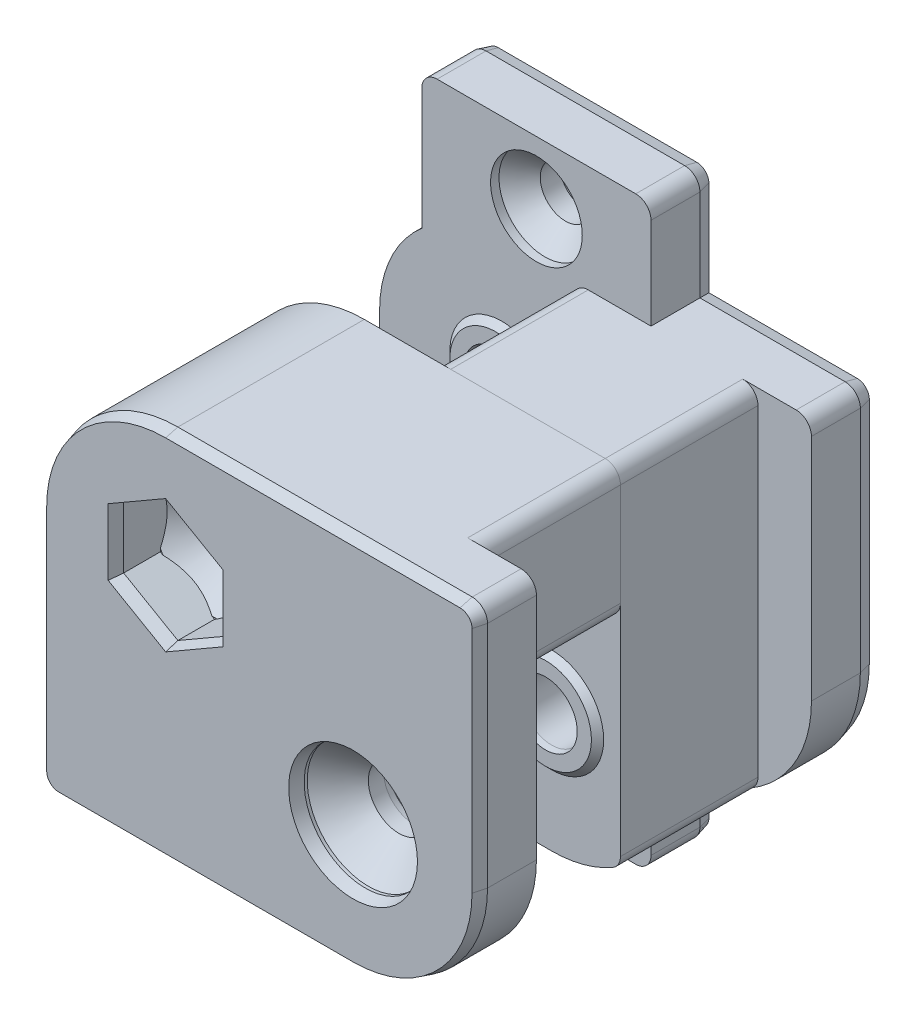
from build123d import *
from OCP.BRepFilletAPI import BRepFilletAPI_MakeChamfer

# Parameters (mm, degrees)
SKETCH2_R       = 2
EXTRUDE1_DEPTH  = 4
SKETCH_R        = 2
EXTRUDE2_DEPTH  = 13
SKETCH3_W       = 3.2
SKETCH3_H       = 16
SKETCH3_W_2     = 3.5
SKETCH3_H_2     = 28.084845023
EXTRUDE3_DEPTH  = 9
FILLET1_R       = 1
EXTRUDE4_START  = 13
SKETCH_2_R      = 2
EXTRUDE4_DEPTH  = 9
SKETCH4_W       = 3.5
SKETCH4_H       = 18.034540852
SKETCH4_W_2     = 21.551595089
SKETCH4_H_2     = 3.2
EXTRUDE5_DEPTH  = 9
EXTRUDE6_START  = 22
SKETCH_3_R      = 2
EXTRUDE6_DEPTH  = 4
SKETCH11_R      = 4
EXTRUDE17_DEPTH = 1
FILLET2_R       = 1
CHAMFER1_SIZE   = 2
SKETCH5_R       = 1.65
SKETCH5_W       = 15
SKETCH5_H       = 7
EXTRUDE7_DEPTH  = 4
SKETCH6_R       = 3
EXTRUDE8_DEPTH  = 14
EXTRUDE8_TAPER  = 3
SKETCH9_R       = 3
EXTRUDE15_DEPTH = 0.4
SKETCH10_R      = 4
EXTRUDE16_DEPTH = 1
CHAMFER2_SIZE   = 1.5
SKETCH7_R       = 2
EXTRUDE9_DEPTH  = 3.2
EXTRUDE10_START = -26
EXTRUDE10_DEPTH = 3.2
CHAMFER3_SIZE   = 2
CHAMFER7_SIZE   = 2
CHAMFER4_SIZE   = 2
SKETCH8_R       = 2
EXTRUDE11_DEPTH = 3.2
EXTRUDE11_DRAFT = -3
SKETCH_5_R      = 2
EXTRUDE12_DEPTH = 3.2
EXTRUDE12_TAPER = 3
SKETCH_6_R      = 2
EXTRUDE13_DEPTH = 3
EXTRUDE13_TAPER = 5
SKETCH_7_R      = 2
EXTRUDE14_DEPTH = 3
EXTRUDE14_DRAFT = -5
FILLET3_R       = 1
CHAMFER5_SIZE   = 0.214359354
CHAMFER5_SIZE_2 = 0.8
CHAMFER6_SIZE   = 0.8
CHAMFER6_SIZE2  = 0.214359354
SKETCH12_R      = 3
SKETCH12_R_2    = 2
EXTRUDE18_DEPTH = 0.4
EXTRUDE18_DRAFT = 10
SKETCH13_R      = 3
SKETCH13_R_2    = 2
EXTRUDE19_DEPTH = 0.4
EXTRUDE19_DRAFT = 10
SKETCH14_R      = 3
SKETCH14_R_2    = 2
EXTRUDE20_DEPTH = 0.4
EXTRUDE20_DRAFT = 10
SKETCH15_R      = 3
SKETCH15_R_2    = 2
EXTRUDE21_DEPTH = 0.4
EXTRUDE21_DRAFT = 10
CHAMFER8_SIZE   = 0.493121221
CHAMFER8_SIZE_2 = 0.4
CHAMFER9_SIZE   = 0.4
CHAMFER9_SIZE_2 = 0.493121221


# Some blends are built 0.0001 mm under size
with BuildPart() as part:
    # Sketch2 → Extrude1 (new body)
    with BuildSketch(Plane.XY):
        with BuildLine():
            ThreePointArc((-6.1325, 12), (-11.789354249, 9.656854249), (-14.1325, 4))
            Line((-14.1325, 4), (-14.1325, -12))
            Line((-14.1325, -12), (6.1325, -12))
            ThreePointArc((6.1325, -12), (11.789354249, -9.656854249), (14.1325, -4))
            Line((14.1325, -4), (14.1325, 12))
            Line((14.1325, 12), (-6.1325, 12))
        make_face()
        with Locations((6.1325, -4)):
            Circle(SKETCH2_R, mode=Mode.SUBTRACT)
        with Locations((-6.1325, 4)):
            Circle(SKETCH2_R, mode=Mode.SUBTRACT)
    extrude(amount=EXTRUDE1_DEPTH)

    # Sketch → Extrude2 (add)
    with BuildSketch(Plane.XY):
        with BuildLine():
            ThreePointArc((-6.1325, 12), (-0.475645751, -1.656854249), (-14.1325, 4))
            Line((-14.1325, 4), (-14.1325, -12))
            Line((-14.1325, -12), (6.1325, -12))
            ThreePointArc((6.1325, -12), (11.789354249, -9.656854249), (14.1325, -4))
            Line((14.1325, -4), (14.1325, 12))
            Line((14.1325, 12), (-6.1325, 12))
        make_face()
        with Locations((6.1325, -4)):
            Circle(SKETCH_R, mode=Mode.SUBTRACT)
    extrude(amount=EXTRUDE2_DEPTH)

    # Sketch3 → Extrude3 (cut)
    with BuildSketch(Plane.XY.offset(13)):
        with Locations((0.2675, -4)):
            Rectangle(SKETCH3_W, SKETCH3_H)
        with Locations((12.3825, -2.042422511)):
            Rectangle(SKETCH3_W_2, SKETCH3_H_2)
    extrude(amount=-EXTRUDE3_DEPTH, mode=Mode.SUBTRACT)

    # Fillet1
    fillet1_edges = [part.edges().sort_by_distance(p)[0] for p in [
        (14.1325, 12, 2),
    ]]
    fillet(fillet1_edges, radius=FILLET1_R)
    fillet1_2_edges = [part.edges().sort_by_distance(p)[0] for p in [
        (10.6325, 12, 8.5),
    ]]
    fillet(fillet1_2_edges, radius=FILLET1_R)
    fillet1_3_edges = [part.edges().sort_by_distance(p)[0] for p in [
        (-14.1325, 4, 8.5),
    ]]
    fillet(fillet1_3_edges, radius=FILLET1_R)
    fillet1_4_edges = [part.edges().sort_by_distance(p)[0] for p in [
        (-14.1325, -12, 6.5),
    ]]
    fillet(fillet1_4_edges, radius=FILLET1_R)
    fillet1_5_edges = [part.edges().sort_by_distance(p)[0] for p in [
        (10.6325, -10.614378278, 8.5),
    ]]
    fillet(fillet1_5_edges, radius=FILLET1_R)
    fillet1_6_edges = [part.edges().sort_by_distance(p)[0] for p in [
        (-1.3325, -2.4, 8.5),
    ]]
    fillet(fillet1_6_edges, radius=FILLET1_R)
    fillet1_7_edges = [part.edges().sort_by_distance(p)[0] for p in [
        (1.8675, -12, 8.5),
    ]]
    fillet(fillet1_7_edges, radius=FILLET1_R)
    fillet1_8_edges = [part.edges().sort_by_distance(p)[0] for p in [
        (-1.3325, -12, 8.5),
    ]]
    fillet(fillet1_8_edges, radius=FILLET1_R)
    fillet1_9_edges = [part.edges().sort_by_distance(p)[0] for p in [
        (-6.1325, 12, 8.5),
    ]]
    fillet(fillet1_9_edges, radius=FILLET1_R)

    # Sketch5 → Extrude7 (add)
    # profile 1 of 2: a face of its own
    with BuildSketch(Plane(origin=(0, 0, 0), x_dir=(-1, 0, 0), z_dir=(0, 0, -1))):
        with BuildLine():
            ThreePointArc((6.1325, 12), (8.925805185, 11.496495591), (11.3675, 10.049361537))
            Line((11.3675, 10.049361537), (11.3675, 19))
            Line((11.3675, 19), (-3.6325, 19))
            Line((-3.6325, 19), (-3.6325, 12))
            Line((-3.6325, 12), (6.1325, 12))
        make_face()
        with Locations((3.8675, 14.9)):
            Circle(SKETCH5_R, mode=Mode.SUBTRACT)
    # profile 2 of 2: a face of its own
    with BuildSketch(Plane(origin=(0, 0, 0), x_dir=(-1, 0, 0), z_dir=(0, 0, -1))):
        with Locations((3.8675, -15.5)):
            Rectangle(SKETCH5_W, SKETCH5_H)
        with Locations((3.8675, -14.9)):
            Circle(SKETCH5_R, mode=Mode.SUBTRACT)
    extrude(amount=-EXTRUDE7_DEPTH)

    # Sketch6 → Extrude8 (cut)
    with BuildSketch(Plane.XY.offset(4)):
        with Locations((-3.8675, -14.9)):
            Circle(SKETCH6_R)
    extrude(amount=EXTRUDE8_DEPTH, taper=EXTRUDE8_TAPER, mode=Mode.SUBTRACT)

    # Sketch9 → Extrude15 (cut)
    with BuildSketch(Plane.XY.offset(4)):
        with Locations((-3.8675, 14.9)):
            Circle(SKETCH9_R)
        with Locations((-3.8675, -14.9)):
            Circle(SKETCH9_R)
    extrude(amount=-EXTRUDE15_DEPTH, mode=Mode.SUBTRACT)

    # Sketch10 → Extrude16 (cut)
    with BuildSketch(Plane(origin=(0, 0, 0), x_dir=(-1, 0, 0), z_dir=(0, 0, -1))):
        with Locations((6.1325, 4)):
            Circle(SKETCH10_R)
    extrude(amount=-EXTRUDE16_DEPTH, mode=Mode.SUBTRACT)

    # Chamfer2
    # the kernel refuses this chamfer: 1.5 mm, written as the material it takes off along each edge
    with BuildSketch(Plane(origin=(-3.8675, -14.9, 3.6), x_dir=(-1, 0, 0), z_dir=(0, -1, 0))) as chamfer2_piece_1_section:
        Polygon((1.65 + CHAMFER2_SIZE, 0), (1.65, CHAMFER2_SIZE), (1.65, 0), align=None)
    chamfer2_piece_1 = revolve(axis=Axis((-3.8675, -14.9, 3.6), (0, 0, -1)), mode=Mode.PRIVATE)
    chamfer2_piece_1 = chamfer2_piece_1 & Plane(origin=(-3.8675, -14.9, 3.6), x_dir=(1, 0, 0), z_dir=(0, 0, 1)) * Cylinder(3, 13, mode=Mode.PRIVATE)
    add(chamfer2_piece_1, mode=Mode.SUBTRACT)
    with BuildSketch(Plane(origin=(-3.8675, 14.9, 3.6), x_dir=(-1, 0, 0), z_dir=(0, -1, 0))) as chamfer2_piece_2_section:
        Polygon((1.65 + CHAMFER2_SIZE, 0), (1.65, CHAMFER2_SIZE), (1.65, 0), align=None)
    chamfer2_piece_2 = revolve(axis=Axis((-3.8675, 14.9, 3.6), (0, 0, -1)), mode=Mode.PRIVATE)
    chamfer2_piece_2 = chamfer2_piece_2 & Plane(origin=(-3.8675, 14.9, 3.6), x_dir=(1, 0, 0), z_dir=(0, 0, 1)) * Cylinder(3, 13, mode=Mode.PRIVATE)
    add(chamfer2_piece_2, mode=Mode.SUBTRACT)

    # Sketch7 → Extrude9 (cut)
    with BuildSketch(Plane(origin=(0, 0, 0), x_dir=(-1, 0, 0), z_dir=(0, 0, -1))):
        Polygon((-2.5825, -6.049593456), (-2.5825, -1.950406544), (-6.1325, 0.099186911), (-9.6825, -1.950406544), (-9.6825, -6.049593456), (-6.1325, -8.099186911), align=None)
        with Locations(Location((-6.1325, -4, 0), (0, 0, 180))):
            Circle(SKETCH7_R, mode=Mode.SUBTRACT)
    extrude(amount=-EXTRUDE9_DEPTH, mode=Mode.SUBTRACT)

    # Chamfer7
    chamfer7_edges = [part.edges().sort_by_distance(p)[0] for p in [
        (-8.1325, 4, 1),
    ]]
    chamfer(chamfer7_edges, length=CHAMFER7_SIZE - 0.0001)  # a hair under: the kernel refuses the full size

    # Chamfer4
    # the kernel refuses this chamfer: 2 mm, written as the material it takes off along each edge
    with BuildSketch(Plane(origin=(6.1325, -4, 3.2), x_dir=(1, 0, 0), z_dir=(0, 1, 0))) as chamfer4_piece_1_section:
        Polygon((2, -CHAMFER4_SIZE), (2 + CHAMFER4_SIZE, 0), (2, 0), align=None)
    chamfer4_piece_1 = revolve(axis=Axis((6.1325, -4, 3.2), (0, 0, -1)), mode=Mode.PRIVATE)
    chamfer4_piece_1 = split(chamfer4_piece_1, bisect_by=Plane(origin=(4.3575, -7.074390183, 3.2), z_dir=(0.49999999999999983, 0.8660254037844388, 0)), keep=Keep.TOP, mode=Mode.PRIVATE)
    chamfer4_piece_1 = split(chamfer4_piece_1, bisect_by=Plane(origin=(7.9075, -7.074390183, 3.2), z_dir=(-0.49999999999999983, 0.8660254037844388, 0)), keep=Keep.TOP, mode=Mode.PRIVATE)
    chamfer4_piece_1 = split(chamfer4_piece_1, bisect_by=Plane(origin=(9.6825, -4, 3.2), z_dir=(-1, 0, 0)), keep=Keep.TOP, mode=Mode.PRIVATE)
    chamfer4_piece_1 = split(chamfer4_piece_1, bisect_by=Plane(origin=(7.9075, -0.925609817, 3.2), z_dir=(-0.4999999999999999, -0.8660254037844388, 0)), keep=Keep.TOP, mode=Mode.PRIVATE)
    chamfer4_piece_1 = split(chamfer4_piece_1, bisect_by=Plane(origin=(4.3575, -0.925609817, 3.2), z_dir=(0.5, -0.8660254037844387, 0)), keep=Keep.TOP, mode=Mode.PRIVATE)
    chamfer4_piece_1 = split(chamfer4_piece_1, bisect_by=Plane(origin=(2.5825, -4, 3.2), z_dir=(1, 0, 0)), keep=Keep.TOP, mode=Mode.PRIVATE)
    add(chamfer4_piece_1, mode=Mode.SUBTRACT)


with BuildPart() as body_2:
    # Sketch 2 → Extrude4 (new body)
    with BuildSketch(Plane.XY.offset(EXTRUDE4_START)):
        with BuildLine():
            Line((14.1325, -4), (14.1325, 12))
            Line((14.1325, 12), (-6.1325, 12))
            ThreePointArc((-6.1325, 12), (-11.789354249, 9.656854249), (-14.1325, 4))
            Line((-14.1325, 4), (-14.1325, -12))
            Line((-14.1325, -12), (6.1325, -12))
            ThreePointArc((6.1325, -12), (0.475645751, 1.656854249), (14.1325, -4))
        make_face()
        with Locations(Location((-6.1325, 4, 0), (0, 0, 180))):
            Circle(SKETCH_2_R, mode=Mode.SUBTRACT)
    extrude(amount=EXTRUDE4_DEPTH)

    # Sketch4 → Extrude5 (cut)
    with BuildSketch(Plane.XY.offset(22)):
        with Locations((12.3825, 2.982729574)):
            Rectangle(SKETCH4_W, SKETCH4_H)
        with Locations((-3.356702455, -10.4)):
            Rectangle(SKETCH4_W_2, SKETCH4_H_2)
    extrude(amount=-EXTRUDE5_DEPTH, mode=Mode.SUBTRACT)

    # Sketch 3 → Extrude6 (add)
    with BuildSketch(Plane.XY.offset(EXTRUDE6_START)):
        with BuildLine():
            ThreePointArc((-6.1325, 12), (-11.789354249, 9.656854249), (-14.1325, 4))
            Line((-14.1325, 4), (-14.1325, -12))
            Line((-14.1325, -12), (6.1325, -12))
            ThreePointArc((6.1325, -12), (11.789354249, -9.656854249), (14.1325, -4))
            Line((14.1325, -4), (14.1325, 12))
            Line((14.1325, 12), (-6.1325, 12))
        make_face()
        with Locations((6.1325, -4)):
            Circle(SKETCH_3_R, mode=Mode.SUBTRACT)
        with Locations(Location((-6.1325, 4, 0), (0, 0, 180))):
            Circle(SKETCH_3_R, mode=Mode.SUBTRACT)
    extrude(amount=EXTRUDE6_DEPTH)

    # Sketch11 → Extrude17 (cut)
    with BuildSketch(Plane.XY.offset(26)):
        with Locations((6.1325, -4)):
            Circle(SKETCH11_R)
    extrude(amount=-EXTRUDE17_DEPTH, mode=Mode.SUBTRACT)

    # Fillet2
    fillet2_edges = [body_2.edges().sort_by_distance(p)[0] for p in [
        (-14.1325, -12, 24),
        (-14.1325, -8.8, 17.5),
        (-0.2675, -8.8, 17.5),
        (10.6325, 2.614378278, 17.5),
        (14.1325, 12, 24),
        (10.6325, 12, 17.5),
    ]]
    fillet(fillet2_edges, radius=FILLET2_R)

    # Chamfer1
    chamfer1_edges = [body_2.edges().sort_by_distance(p)[0] for p in [
        (4.1325, -4, 25),
    ]]
    chamfer(chamfer1_edges, length=CHAMFER1_SIZE - 0.0001)  # a hair under: the kernel refuses the full size

    # Sketch 4 → Extrude10 (cut)
    with BuildSketch(Plane(origin=(0, 0, 0), x_dir=(-1, 0, 0), z_dir=(0, 0, -1)).offset(EXTRUDE10_START)):
        Polygon((6.1325, 8.099186911), (2.5825, 6.049593456), (2.5825, 1.950406544), (6.1325, -0.099186911), (9.6825, 1.950406544), (9.6825, 6.049593456), align=None)
    extrude(amount=EXTRUDE10_DEPTH, mode=Mode.SUBTRACT)

    # Chamfer3
    # the kernel refuses this chamfer: 2 mm, written as the material it takes off along each edge
    with BuildSketch(Plane(origin=(-6.1325, 4, 22.8), x_dir=(-1, 0, 0), z_dir=(0, -1, 0))) as chamfer3_piece_1_section:
        Polygon((2, CHAMFER3_SIZE), (2 + CHAMFER3_SIZE, 0), (2, 0), align=None)
    chamfer3_piece_1 = revolve(axis=Axis((-6.1325, 4, 22.8), (0, 0, -1)), mode=Mode.PRIVATE)
    chamfer3_piece_1 = split(chamfer3_piece_1, bisect_by=Plane(origin=(-7.9075, 7.074390183, 22.8), z_dir=(0.5, -0.8660254037844387, 0)), keep=Keep.TOP, mode=Mode.PRIVATE)
    chamfer3_piece_1 = split(chamfer3_piece_1, bisect_by=Plane(origin=(-9.6825, 4, 22.8), z_dir=(1, 0, 0)), keep=Keep.TOP, mode=Mode.PRIVATE)
    chamfer3_piece_1 = split(chamfer3_piece_1, bisect_by=Plane(origin=(-7.9075, 0.925609817, 22.8), z_dir=(0.5000000000000001, 0.8660254037844387, 0)), keep=Keep.TOP, mode=Mode.PRIVATE)
    chamfer3_piece_1 = split(chamfer3_piece_1, bisect_by=Plane(origin=(-4.3575, 0.925609817, 22.8), z_dir=(-0.5000000000000001, 0.8660254037844387, 0)), keep=Keep.TOP, mode=Mode.PRIVATE)
    chamfer3_piece_1 = split(chamfer3_piece_1, bisect_by=Plane(origin=(-2.5825, 4, 22.8), z_dir=(-1, 0, 0)), keep=Keep.TOP, mode=Mode.PRIVATE)
    chamfer3_piece_1 = split(chamfer3_piece_1, bisect_by=Plane(origin=(-4.3575, 7.074390183, 22.8), z_dir=(-0.5000000000000001, -0.8660254037844387, 0)), keep=Keep.TOP, mode=Mode.PRIVATE)
    add(chamfer3_piece_1, mode=Mode.SUBTRACT)

    # Sketch 5 → Extrude12 (cut)
    with BuildSketch(Plane.XY.offset(13)):
        with Locations((6.6325, 8)):
            Circle(SKETCH_5_R)
    extrude(amount=EXTRUDE12_DEPTH, taper=EXTRUDE12_TAPER, mode=Mode.SUBTRACT)


with BuildPart() as extrude11_tool:
    # Sketch8 → Extrude11 (with draft: the straight prism first)
    with BuildSketch(Plane.XY.offset(13)):
        with Locations((-11.1325, -5.8)):
            Circle(SKETCH8_R)
    extrude(amount=-EXTRUDE11_DEPTH)
    # Extrude11: the draft: its side faces are tilted about the plane it starts from
    extrude11_sides = [extrude11_tool.faces().sort_by_distance(p)[0] for p in [
        (-13.1325, -5.8, 11.4),
    ]]
    draft(extrude11_sides, Plane.XY.offset(13), EXTRUDE11_DRAFT)


with BuildPart() as part_1:
    add(part.part)

    # Extrude11: cut by extrude11_tool
    add(extrude11_tool.part, mode=Mode.SUBTRACT)

    # Sketch 6 → Extrude13 (add)
    with BuildSketch(Plane.XY.offset(13)):
        with Locations((6.6325, 8)):
            Circle(SKETCH_6_R)
    extrude(amount=EXTRUDE13_DEPTH, taper=EXTRUDE13_TAPER)

    # Fillet3
    fillet3_edges = [part_1.edges().sort_by_distance(p)[0] for p in [
        (3.6325, 19, 2),
        (-11.3675, 19, 2),
        (3.6325, -19, 2),
        (-11.3675, -19, 2),
    ]]
    fillet(fillet3_edges, radius=FILLET3_R)

    # Chamfer5
    # the kernel refuses this chamfer: 0.8, 0.214359354 mm, written as the material it takes off along each edge
    with BuildSketch(Plane(origin=(14.1325, -4, 0), x_dir=(-1, 0, 0), z_dir=(0, 1, 0))) as chamfer5_piece_1:
        Polygon((CHAMFER5_SIZE, 0), (0, CHAMFER5_SIZE_2), (0, 0), align=None)
    extrude(amount=15, mode=Mode.SUBTRACT)
    with BuildSketch(Plane(origin=(6.1325, -4, 0), x_dir=(0, -1, 0), z_dir=(-1, 0, 0))) as chamfer5_piece_2:
        Polygon((8 - CHAMFER5_SIZE, 0), (8, CHAMFER5_SIZE_2), (8, 0), align=None)
    revolve(axis=Axis((6.1325, -4, 0), (0, 0, 1)), revolution_arc=90, mode=Mode.SUBTRACT)
    with BuildSketch(Plane(origin=(-13.1325, -11, 0), x_dir=(-1, 0, 0), z_dir=(0, 1, 0))) as chamfer5_piece_3:
        Polygon((1 - CHAMFER5_SIZE, 0), (1, CHAMFER5_SIZE_2), (1, 0), align=None)
    revolve(axis=Axis((-13.1325, -11, 0), (0, 0, 1)), revolution_arc=90, mode=Mode.SUBTRACT)
    with BuildSketch(Plane(origin=(13.1325, 11, 0), x_dir=(0, 1, 0), z_dir=(-1, 0, 0))) as chamfer5_piece_4:
        Polygon((1 - CHAMFER5_SIZE, 0), (1, -CHAMFER5_SIZE_2), (1, 0), align=None)
    revolve(axis=Axis((13.1325, 11, 0), (0, 0, -1)), revolution_arc=90, mode=Mode.SUBTRACT)
    with BuildSketch(Plane(origin=(3.6325, -12, 0), x_dir=(0, 0, 1), z_dir=(1, 0, 0))) as chamfer5_piece_5:
        Polygon((CHAMFER5_SIZE_2, 0), (0, -CHAMFER5_SIZE), (0, 0), align=None)
    extrude(amount=2.5, mode=Mode.SUBTRACT)
    with BuildSketch(Plane(origin=(-14.1325, 4, 0), x_dir=(0, 0, 1), z_dir=(0, -1, 0))) as chamfer5_piece_6:
        Polygon((CHAMFER5_SIZE_2, 0), (0, -CHAMFER5_SIZE), (0, 0), align=None)
    extrude(amount=15, mode=Mode.SUBTRACT)
    with BuildSketch(Plane(origin=(-6.1325, 4, 0), x_dir=(-0.43825156105589536, 0.8988523623110032, 0), z_dir=(0.8988523623110032, 0.43825156105589536, 0))) as chamfer5_piece_7_section:
        Polygon((8, CHAMFER5_SIZE_2), (8 - CHAMFER5_SIZE, 0), (8, 0), align=None)
    chamfer5_piece_7 = revolve(axis=Axis((-6.1325, 4, 0), (0, 0, 1)), revolution_arc=64.007623032, mode=Mode.PRIVATE)
    chamfer5_piece_7 = split(chamfer5_piece_7, bisect_by=Plane(origin=(-11.3675, 4, 0), z_dir=(-1, 0, 0)), keep=Keep.TOP, mode=Mode.PRIVATE)
    add(chamfer5_piece_7, mode=Mode.SUBTRACT)
    with BuildSketch(Plane(origin=(13.1325, 12, 0), x_dir=(0, 0, 1), z_dir=(-1, 0, 0))) as chamfer5_piece_8:
        Polygon((CHAMFER5_SIZE_2, 0), (0, -CHAMFER5_SIZE), (0, 0), align=None)
    extrude(amount=9.5, mode=Mode.SUBTRACT)
    with BuildSketch(Plane(origin=(3.6325, 18, 0), x_dir=(0, 0, 1), z_dir=(0, -1, 0)), Plane(origin=(3.6325, -12, 0), x_dir=(0, 0, 1), z_dir=(0, -1, 0)), Plane(origin=(-11.3675, -18, 0), x_dir=(0, 0, 1), z_dir=(0, 1, 0))) as chamfer5_piece_9:
        Polygon((CHAMFER5_SIZE_2, 0), (0, CHAMFER5_SIZE), (0, 0), align=None)
    extrude(amount=6, mode=Mode.SUBTRACT)
    with BuildSketch(Plane(origin=(-3.8675, 14.9, 0), x_dir=(-1, 0, 0), z_dir=(0, -1, 0))) as chamfer5_piece_10:
        Polygon((1.65 + CHAMFER5_SIZE, 0), (1.65, -CHAMFER5_SIZE_2), (1.65, 0), align=None)
    revolve(axis=Axis((-3.8675, 14.9, 0), (0, 0, -1)), mode=Mode.SUBTRACT)
    with BuildSketch(Plane(origin=(-11.3675, 7.97198428, 0), x_dir=(0, 0, 1), z_dir=(0, 1, 0))) as chamfer5_piece_11_section:
        Polygon((CHAMFER5_SIZE_2, 0), (0, CHAMFER5_SIZE), (0, 0), align=None)
    chamfer5_piece_11 = extrude(amount=10.02801572, mode=Mode.PRIVATE)
    chamfer5_piece_11 = chamfer5_piece_11 - Plane(origin=(-6.1325, 4, 0), x_dir=(0, 1, 0), z_dir=(0, 0, -1)) * Cylinder(8, 24, mode=Mode.PRIVATE)
    add(chamfer5_piece_11, mode=Mode.SUBTRACT)
    with BuildSketch(Plane(origin=(-13.1325, -12, 0), x_dir=(0, 0, 1), z_dir=(1, 0, 0))) as chamfer5_piece_12:
        Polygon((CHAMFER5_SIZE_2, 0), (0, -CHAMFER5_SIZE), (0, 0), align=None)
    extrude(amount=1.765, mode=Mode.SUBTRACT)
    with BuildSketch(Plane(origin=(-3.8675, -14.9, 0), x_dir=(-1, 0, 0), z_dir=(0, -1, 0))) as chamfer5_piece_13:
        Polygon((1.65 + CHAMFER5_SIZE, 0), (1.65, -CHAMFER5_SIZE_2), (1.65, 0), align=None)
    revolve(axis=Axis((-3.8675, -14.9, 0), (0, 0, -1)), mode=Mode.SUBTRACT)
    with BuildSketch(Plane(origin=(-6.1325, 4, 0), x_dir=(-1, 0, 0), z_dir=(0, -1, 0))) as chamfer5_piece_14:
        Polygon((4 + CHAMFER5_SIZE, 0), (4, -CHAMFER5_SIZE_2), (4, 0), align=None)
    revolve(axis=Axis((-6.1325, 4, 0), (0, 0, -1)), mode=Mode.SUBTRACT)
    with BuildSketch(Plane(origin=(2.5825, -8.126970712, 0), x_dir=(-1, 0, 0), z_dir=(0, 1, 0))) as chamfer5_piece_15_section:
        Polygon((CHAMFER5_SIZE, 0), (0, CHAMFER5_SIZE_2), (0, 0), align=None)
    chamfer5_piece_15 = extrude(amount=8.253941424, mode=Mode.PRIVATE)
    chamfer5_piece_15 = split(chamfer5_piece_15, bisect_by=Plane(origin=(3.482030739, -6.56893777, 0), z_dir=(0.49999999999999983, 0.8660254037844388, 0)), keep=Keep.TOP, mode=Mode.PRIVATE)
    chamfer5_piece_15 = split(chamfer5_piece_15, bisect_by=Plane(origin=(-0.092030739, -3.494547586, 0), z_dir=(0.5, -0.8660254037844387, 0)), keep=Keep.TOP, mode=Mode.PRIVATE)
    add(chamfer5_piece_15, mode=Mode.SUBTRACT)
    with BuildSketch(Plane(origin=(0.783438523, -2.989095172, 0), x_dir=(-0.5, 0.8660254037844387, 0), z_dir=(0.8660254037844387, 0.5, 0))) as chamfer5_piece_16_section:
        Polygon((CHAMFER5_SIZE, 0), (0, CHAMFER5_SIZE_2), (0, 0), align=None)
    chamfer5_piece_16 = extrude(amount=8.253941424, mode=Mode.PRIVATE)
    chamfer5_piece_16 = split(chamfer5_piece_16, bisect_by=Plane(origin=(3.457969261, 1.643327953, 0), z_dir=(-0.4999999999999999, -0.8660254037844388, 0)), keep=Keep.TOP, mode=Mode.PRIVATE)
    chamfer5_piece_16 = split(chamfer5_piece_16, bisect_by=Plane(origin=(2.5825, -2.989095172, 0), z_dir=(1, 0, 0)), keep=Keep.TOP, mode=Mode.PRIVATE)
    add(chamfer5_piece_16, mode=Mode.SUBTRACT)
    with BuildSketch(Plane(origin=(4.333438523, 1.137875539, 0), x_dir=(0.4999999999999999, 0.8660254037844388, 0), z_dir=(0.8660254037844388, -0.4999999999999999, 0))) as chamfer5_piece_17_section:
        Polygon((CHAMFER5_SIZE, 0), (0, CHAMFER5_SIZE_2), (0, 0), align=None)
    chamfer5_piece_17 = extrude(amount=8.253941424, mode=Mode.PRIVATE)
    chamfer5_piece_17 = split(chamfer5_piece_17, bisect_by=Plane(origin=(9.6825, 1.137875539, 0), z_dir=(-1, 0, 0)), keep=Keep.TOP, mode=Mode.PRIVATE)
    chamfer5_piece_17 = split(chamfer5_piece_17, bisect_by=Plane(origin=(5.232969261, -0.420157403, 0), z_dir=(0.5, -0.8660254037844387, 0)), keep=Keep.TOP, mode=Mode.PRIVATE)
    add(chamfer5_piece_17, mode=Mode.SUBTRACT)
    with BuildSketch(Plane(origin=(9.6825, 0.126970712, 0), x_dir=(1, 0, 0), z_dir=(0, -1, 0))) as chamfer5_piece_18_section:
        Polygon((CHAMFER5_SIZE, 0), (0, CHAMFER5_SIZE_2), (0, 0), align=None)
    chamfer5_piece_18 = extrude(amount=8.253941424, mode=Mode.PRIVATE)
    chamfer5_piece_18 = split(chamfer5_piece_18, bisect_by=Plane(origin=(12.357030739, -4.505452414, 0), z_dir=(-0.49999999999999983, 0.8660254037844388, 0)), keep=Keep.TOP, mode=Mode.PRIVATE)
    chamfer5_piece_18 = split(chamfer5_piece_18, bisect_by=Plane(origin=(8.782969261, -1.43106223, 0), z_dir=(-0.4999999999999999, -0.8660254037844388, 0)), keep=Keep.TOP, mode=Mode.PRIVATE)
    add(chamfer5_piece_18, mode=Mode.SUBTRACT)
    with BuildSketch(Plane(origin=(11.481561477, -5.010904828, 0), x_dir=(0.4999999999999999, -0.8660254037844388, 0), z_dir=(-0.8660254037844388, -0.49999999999999983, 0))) as chamfer5_piece_19_section:
        Polygon((CHAMFER5_SIZE, 0), (0, CHAMFER5_SIZE_2), (0, 0), align=None)
    chamfer5_piece_19 = extrude(amount=8.253941424, mode=Mode.PRIVATE)
    chamfer5_piece_19 = split(chamfer5_piece_19, bisect_by=Plane(origin=(8.807030739, -9.643327953, 0), z_dir=(0.49999999999999983, 0.8660254037844388, 0)), keep=Keep.TOP, mode=Mode.PRIVATE)
    chamfer5_piece_19 = split(chamfer5_piece_19, bisect_by=Plane(origin=(9.6825, -5.010904828, 0), z_dir=(-1, 0, 0)), keep=Keep.TOP, mode=Mode.PRIVATE)
    add(chamfer5_piece_19, mode=Mode.SUBTRACT)
    with BuildSketch(Plane(origin=(7.931561477, -9.137875539, 0), x_dir=(-0.49999999999999983, -0.8660254037844388, 0), z_dir=(-0.8660254037844388, 0.49999999999999983, 0))) as chamfer5_piece_20_section:
        Polygon((CHAMFER5_SIZE, 0), (0, CHAMFER5_SIZE_2), (0, 0), align=None)
    chamfer5_piece_20 = extrude(amount=8.253941424, mode=Mode.PRIVATE)
    chamfer5_piece_20 = split(chamfer5_piece_20, bisect_by=Plane(origin=(7.032030739, -7.579842597, 0), z_dir=(-0.49999999999999983, 0.8660254037844388, 0)), keep=Keep.TOP, mode=Mode.PRIVATE)
    chamfer5_piece_20 = split(chamfer5_piece_20, bisect_by=Plane(origin=(2.5825, -9.137875539, 0), z_dir=(1, 0, 0)), keep=Keep.TOP, mode=Mode.PRIVATE)
    add(chamfer5_piece_20, mode=Mode.SUBTRACT)
    with BuildSketch(Plane(origin=(2.6325, -19, 0), x_dir=(0, 0, 1), z_dir=(-1, 0, 0)), Plane(origin=(-10.3675, 19, 0), x_dir=(0, 0, 1), z_dir=(1, 0, 0))) as chamfer5_piece_21:
        Polygon((CHAMFER5_SIZE_2, 0), (0, CHAMFER5_SIZE), (0, 0), align=None)
    extrude(amount=13, mode=Mode.SUBTRACT)
    with BuildSketch(Plane(origin=(2.6325, 18, 0), x_dir=(0, 1, 0), z_dir=(-1, 0, 0))) as chamfer5_piece_22:
        Polygon((1, -CHAMFER5_SIZE_2), (1 - CHAMFER5_SIZE, 0), (1, 0), align=None)
    revolve(axis=Axis((2.6325, 18, 0), (0, 0, -1)), revolution_arc=90, mode=Mode.SUBTRACT)
    with BuildSketch(Plane(origin=(-10.3675, 18, 0), x_dir=(-1, 0, 0), z_dir=(0, -1, 0))) as chamfer5_piece_23:
        Polygon((1, -CHAMFER5_SIZE_2), (1 - CHAMFER5_SIZE, 0), (1, 0), align=None)
    revolve(axis=Axis((-10.3675, 18, 0), (0, 0, -1)), revolution_arc=90, mode=Mode.SUBTRACT)
    with BuildSketch(Plane(origin=(2.6325, -18, 0), x_dir=(1, 0, 0), z_dir=(0, 1, 0))) as chamfer5_piece_24:
        Polygon((1, -CHAMFER5_SIZE_2), (1 - CHAMFER5_SIZE, 0), (1, 0), align=None)
    revolve(axis=Axis((2.6325, -18, 0), (0, 0, -1)), revolution_arc=90, mode=Mode.SUBTRACT)
    with BuildSketch(Plane(origin=(-10.3675, -18, 0), x_dir=(0, -1, 0), z_dir=(1, 0, 0))) as chamfer5_piece_25:
        Polygon((1, -CHAMFER5_SIZE_2), (1 - CHAMFER5_SIZE, 0), (1, 0), align=None)
    revolve(axis=Axis((-10.3675, -18, 0), (0, 0, -1)), revolution_arc=90, mode=Mode.SUBTRACT)
    with BuildSketch(Plane(origin=(3.6325, -9.922622744, 0), x_dir=(0, 0, 1), z_dir=(0, -1, 0))) as chamfer5_piece_26a_section:
        Polygon((CHAMFER5_SIZE_2, 0), (0, CHAMFER5_SIZE), (0, 0), align=None)
    chamfer5_piece_26a = extrude(amount=8.077377256, mode=Mode.PRIVATE)
    chamfer5_piece_26a = split(chamfer5_piece_26a, bisect_by=Plane(origin=(3.6325, -12, 0), z_dir=(0, 1, 0)), keep=Keep.TOP, mode=Mode.PRIVATE)
    with BuildSketch(Plane(origin=(1.555122744, -12, 0), x_dir=(0, 0, 1), z_dir=(1, 0, 0))) as chamfer5_piece_26b_section:
        Polygon((CHAMFER5_SIZE_2, 0), (0, -CHAMFER5_SIZE), (0, 0), align=None)
    chamfer5_piece_26b = extrude(amount=4.577377256, mode=Mode.PRIVATE)
    chamfer5_piece_26b = split(chamfer5_piece_26b, bisect_by=Plane(origin=(3.6325, -12, 0), z_dir=(-1, 0, 0)), keep=Keep.TOP, mode=Mode.PRIVATE)
    chamfer5_piece_26 = chamfer5_piece_26a & chamfer5_piece_26b
    add(chamfer5_piece_26, mode=Mode.SUBTRACT)
    with BuildSketch(Plane(origin=(-11.3675, 7.97198428, 0), x_dir=(0, 0, 1), z_dir=(0, 1, 0))) as chamfer5_piece_27a_section:
        Polygon((CHAMFER5_SIZE_2, 0), (0, CHAMFER5_SIZE), (0, 0), align=None)
    chamfer5_piece_27a = extrude(amount=10.02801572, mode=Mode.PRIVATE)
    chamfer5_piece_27a = chamfer5_piece_27a & Plane(origin=(-6.1325, 4, 0), x_dir=(0, 1, 0), z_dir=(0, 0, -1)) * Cylinder(8, 24, mode=Mode.PRIVATE)
    with BuildSketch(Plane(origin=(-6.1325, 4, 0), x_dir=(-0.43825156105589536, 0.8988523623110032, 0), z_dir=(0.8988523623110032, 0.43825156105589536, 0))) as chamfer5_piece_27b_section:
        Polygon((8, CHAMFER5_SIZE_2), (8 - CHAMFER5_SIZE, 0), (8, 0), align=None)
    chamfer5_piece_27b = revolve(axis=Axis((-6.1325, 4, 0), (0, 0, 1)), revolution_arc=64.007623032, mode=Mode.PRIVATE)
    chamfer5_piece_27b = split(chamfer5_piece_27b, bisect_by=Plane(origin=(-11.3675, 4, 0), z_dir=(1, 0, 0)), keep=Keep.TOP, mode=Mode.PRIVATE)
    chamfer5_piece_27 = chamfer5_piece_27a & chamfer5_piece_27b
    add(chamfer5_piece_27, mode=Mode.SUBTRACT)
    with BuildSketch(Plane(origin=(13.1325, 12, 0), x_dir=(0, 0, 1), z_dir=(-1, 0, 0))) as chamfer5_piece_28a_section:
        Polygon((CHAMFER5_SIZE_2, 0), (0, -CHAMFER5_SIZE), (0, 0), align=None)
    chamfer5_piece_28a = extrude(amount=11.577377256, mode=Mode.PRIVATE)
    chamfer5_piece_28a = split(chamfer5_piece_28a, bisect_by=Plane(origin=(3.6325, 12, 0), z_dir=(-1, 0, 0)), keep=Keep.TOP, mode=Mode.PRIVATE)
    with BuildSketch(Plane(origin=(3.6325, 18, 0), x_dir=(0, 0, 1), z_dir=(0, -1, 0))) as chamfer5_piece_28b_section:
        Polygon((CHAMFER5_SIZE_2, 0), (0, CHAMFER5_SIZE), (0, 0), align=None)
    chamfer5_piece_28b = extrude(amount=8.077377256, mode=Mode.PRIVATE)
    chamfer5_piece_28b = split(chamfer5_piece_28b, bisect_by=Plane(origin=(3.6325, 12, 0), z_dir=(0, -1, 0)), keep=Keep.TOP, mode=Mode.PRIVATE)
    chamfer5_piece_28 = chamfer5_piece_28a & chamfer5_piece_28b
    add(chamfer5_piece_28, mode=Mode.SUBTRACT)
    with BuildSketch(Plane(origin=(-11.3675, -18, 0), x_dir=(0, 0, 1), z_dir=(0, 1, 0))) as chamfer5_piece_29a_section:
        Polygon((CHAMFER5_SIZE_2, 0), (0, CHAMFER5_SIZE), (0, 0), align=None)
    chamfer5_piece_29a = extrude(amount=8.077377256, mode=Mode.PRIVATE)
    chamfer5_piece_29a = split(chamfer5_piece_29a, bisect_by=Plane(origin=(-11.3675, -12, 0), z_dir=(0, 1, 0)), keep=Keep.TOP, mode=Mode.PRIVATE)
    with BuildSketch(Plane(origin=(-13.1325, -12, 0), x_dir=(0, 0, 1), z_dir=(1, 0, 0))) as chamfer5_piece_29b_section:
        Polygon((CHAMFER5_SIZE_2, 0), (0, -CHAMFER5_SIZE), (0, 0), align=None)
    chamfer5_piece_29b = extrude(amount=3.842377256, mode=Mode.PRIVATE)
    chamfer5_piece_29b = split(chamfer5_piece_29b, bisect_by=Plane(origin=(-11.3675, -12, 0), z_dir=(1, 0, 0)), keep=Keep.TOP, mode=Mode.PRIVATE)
    chamfer5_piece_29 = chamfer5_piece_29a & chamfer5_piece_29b
    add(chamfer5_piece_29, mode=Mode.SUBTRACT)
    with BuildSketch(Plane(origin=(7.931561477, -9.137875539, 0), x_dir=(-0.49999999999999983, -0.8660254037844388, 0), z_dir=(-0.8660254037844388, 0.49999999999999983, 0))) as chamfer5_piece_30a_section:
        Polygon((CHAMFER5_SIZE, 0), (0, CHAMFER5_SIZE_2), (0, 0), align=None)
    chamfer5_piece_30a = extrude(amount=8.253941424, mode=Mode.PRIVATE)
    chamfer5_piece_30a = split(chamfer5_piece_30a, bisect_by=Plane(origin=(2.5825, -9.137875539, 0), z_dir=(-1, 0, 0)), keep=Keep.TOP, mode=Mode.PRIVATE)
    with BuildSketch(Plane(origin=(2.5825, -8.126970712, 0), x_dir=(-1, 0, 0), z_dir=(0, 1, 0))) as chamfer5_piece_30b_section:
        Polygon((CHAMFER5_SIZE, 0), (0, CHAMFER5_SIZE_2), (0, 0), align=None)
    chamfer5_piece_30b = extrude(amount=8.253941424, mode=Mode.PRIVATE)
    chamfer5_piece_30b = split(chamfer5_piece_30b, bisect_by=Plane(origin=(3.482030739, -6.56893777, 0), z_dir=(-0.49999999999999983, -0.8660254037844388, 0)), keep=Keep.TOP, mode=Mode.PRIVATE)
    chamfer5_piece_30 = chamfer5_piece_30a & chamfer5_piece_30b
    add(chamfer5_piece_30, mode=Mode.SUBTRACT)
    with BuildSketch(Plane(origin=(0.783438523, -2.989095172, 0), x_dir=(-0.5, 0.8660254037844387, 0), z_dir=(0.8660254037844387, 0.5, 0))) as chamfer5_piece_31a_section:
        Polygon((CHAMFER5_SIZE, 0), (0, CHAMFER5_SIZE_2), (0, 0), align=None)
    chamfer5_piece_31a = extrude(amount=8.253941424, mode=Mode.PRIVATE)
    chamfer5_piece_31a = split(chamfer5_piece_31a, bisect_by=Plane(origin=(2.5825, -2.989095172, 0), z_dir=(-1, 0, 0)), keep=Keep.TOP, mode=Mode.PRIVATE)
    with BuildSketch(Plane(origin=(2.5825, -8.126970712, 0), x_dir=(-1, 0, 0), z_dir=(0, 1, 0))) as chamfer5_piece_31b_section:
        Polygon((CHAMFER5_SIZE, 0), (0, CHAMFER5_SIZE_2), (0, 0), align=None)
    chamfer5_piece_31b = extrude(amount=8.253941424, mode=Mode.PRIVATE)
    chamfer5_piece_31b = split(chamfer5_piece_31b, bisect_by=Plane(origin=(-0.092030739, -3.494547586, 0), z_dir=(-0.5, 0.8660254037844387, 0)), keep=Keep.TOP, mode=Mode.PRIVATE)
    chamfer5_piece_31 = chamfer5_piece_31a & chamfer5_piece_31b
    add(chamfer5_piece_31, mode=Mode.SUBTRACT)
    with BuildSketch(Plane(origin=(4.333438523, 1.137875539, 0), x_dir=(0.4999999999999999, 0.8660254037844388, 0), z_dir=(0.8660254037844388, -0.4999999999999999, 0))) as chamfer5_piece_32a_section:
        Polygon((CHAMFER5_SIZE, 0), (0, CHAMFER5_SIZE_2), (0, 0), align=None)
    chamfer5_piece_32a = extrude(amount=8.253941424, mode=Mode.PRIVATE)
    chamfer5_piece_32a = split(chamfer5_piece_32a, bisect_by=Plane(origin=(5.232969261, -0.420157403, 0), z_dir=(-0.5, 0.8660254037844387, 0)), keep=Keep.TOP, mode=Mode.PRIVATE)
    with BuildSketch(Plane(origin=(0.783438523, -2.989095172, 0), x_dir=(-0.5, 0.8660254037844387, 0), z_dir=(0.8660254037844387, 0.5, 0))) as chamfer5_piece_32b_section:
        Polygon((CHAMFER5_SIZE, 0), (0, CHAMFER5_SIZE_2), (0, 0), align=None)
    chamfer5_piece_32b = extrude(amount=8.253941424, mode=Mode.PRIVATE)
    chamfer5_piece_32b = split(chamfer5_piece_32b, bisect_by=Plane(origin=(3.457969261, 1.643327953, 0), z_dir=(0.4999999999999999, 0.8660254037844388, 0)), keep=Keep.TOP, mode=Mode.PRIVATE)
    chamfer5_piece_32 = chamfer5_piece_32a & chamfer5_piece_32b
    add(chamfer5_piece_32, mode=Mode.SUBTRACT)
    with BuildSketch(Plane(origin=(9.6825, 0.126970712, 0), x_dir=(1, 0, 0), z_dir=(0, -1, 0))) as chamfer5_piece_33a_section:
        Polygon((CHAMFER5_SIZE, 0), (0, CHAMFER5_SIZE_2), (0, 0), align=None)
    chamfer5_piece_33a = extrude(amount=8.253941424, mode=Mode.PRIVATE)
    chamfer5_piece_33a = split(chamfer5_piece_33a, bisect_by=Plane(origin=(8.782969261, -1.43106223, 0), z_dir=(0.4999999999999999, 0.8660254037844388, 0)), keep=Keep.TOP, mode=Mode.PRIVATE)
    with BuildSketch(Plane(origin=(4.333438523, 1.137875539, 0), x_dir=(0.4999999999999999, 0.8660254037844388, 0), z_dir=(0.8660254037844388, -0.4999999999999999, 0))) as chamfer5_piece_33b_section:
        Polygon((CHAMFER5_SIZE, 0), (0, CHAMFER5_SIZE_2), (0, 0), align=None)
    chamfer5_piece_33b = extrude(amount=8.253941424, mode=Mode.PRIVATE)
    chamfer5_piece_33b = split(chamfer5_piece_33b, bisect_by=Plane(origin=(9.6825, 1.137875539, 0), z_dir=(1, 0, 0)), keep=Keep.TOP, mode=Mode.PRIVATE)
    chamfer5_piece_33 = chamfer5_piece_33a & chamfer5_piece_33b
    add(chamfer5_piece_33, mode=Mode.SUBTRACT)
    with BuildSketch(Plane(origin=(11.481561477, -5.010904828, 0), x_dir=(0.4999999999999999, -0.8660254037844388, 0), z_dir=(-0.8660254037844388, -0.49999999999999983, 0))) as chamfer5_piece_34a_section:
        Polygon((CHAMFER5_SIZE, 0), (0, CHAMFER5_SIZE_2), (0, 0), align=None)
    chamfer5_piece_34a = extrude(amount=8.253941424, mode=Mode.PRIVATE)
    chamfer5_piece_34a = split(chamfer5_piece_34a, bisect_by=Plane(origin=(9.6825, -5.010904828, 0), z_dir=(1, 0, 0)), keep=Keep.TOP, mode=Mode.PRIVATE)
    with BuildSketch(Plane(origin=(9.6825, 0.126970712, 0), x_dir=(1, 0, 0), z_dir=(0, -1, 0))) as chamfer5_piece_34b_section:
        Polygon((CHAMFER5_SIZE, 0), (0, CHAMFER5_SIZE_2), (0, 0), align=None)
    chamfer5_piece_34b = extrude(amount=8.253941424, mode=Mode.PRIVATE)
    chamfer5_piece_34b = split(chamfer5_piece_34b, bisect_by=Plane(origin=(12.357030739, -4.505452414, 0), z_dir=(0.49999999999999983, -0.8660254037844388, 0)), keep=Keep.TOP, mode=Mode.PRIVATE)
    chamfer5_piece_34 = chamfer5_piece_34a & chamfer5_piece_34b
    add(chamfer5_piece_34, mode=Mode.SUBTRACT)
    with BuildSketch(Plane(origin=(7.931561477, -9.137875539, 0), x_dir=(-0.49999999999999983, -0.8660254037844388, 0), z_dir=(-0.8660254037844388, 0.49999999999999983, 0))) as chamfer5_piece_35a_section:
        Polygon((CHAMFER5_SIZE, 0), (0, CHAMFER5_SIZE_2), (0, 0), align=None)
    chamfer5_piece_35a = extrude(amount=8.253941424, mode=Mode.PRIVATE)
    chamfer5_piece_35a = split(chamfer5_piece_35a, bisect_by=Plane(origin=(7.032030739, -7.579842597, 0), z_dir=(0.49999999999999983, -0.8660254037844388, 0)), keep=Keep.TOP, mode=Mode.PRIVATE)
    with BuildSketch(Plane(origin=(11.481561477, -5.010904828, 0), x_dir=(0.4999999999999999, -0.8660254037844388, 0), z_dir=(-0.8660254037844388, -0.49999999999999983, 0))) as chamfer5_piece_35b_section:
        Polygon((CHAMFER5_SIZE, 0), (0, CHAMFER5_SIZE_2), (0, 0), align=None)
    chamfer5_piece_35b = extrude(amount=8.253941424, mode=Mode.PRIVATE)
    chamfer5_piece_35b = split(chamfer5_piece_35b, bisect_by=Plane(origin=(8.807030739, -9.643327953, 0), z_dir=(-0.49999999999999983, -0.8660254037844388, 0)), keep=Keep.TOP, mode=Mode.PRIVATE)
    chamfer5_piece_35 = chamfer5_piece_35a & chamfer5_piece_35b
    add(chamfer5_piece_35, mode=Mode.SUBTRACT)


with BuildPart() as extrude14_tool:
    # Sketch 7 → Extrude14 (with draft: the straight prism first)
    with BuildSketch(Plane.XY.offset(13)):
        with Locations((-11.1325, -5.8)):
            Circle(SKETCH_7_R)
    extrude(amount=-EXTRUDE14_DEPTH)
    # Extrude14: the draft: its side faces are tilted about the plane it starts from
    extrude14_sides = [extrude14_tool.faces().sort_by_distance(p)[0] for p in [
        (-13.1325, -5.8, 11.5),
    ]]
    draft(extrude14_sides, Plane.XY.offset(13), EXTRUDE14_DRAFT)


with BuildPart() as body_2_1:
    add(body_2.part)

    # Extrude14: add extrude14_tool
    add(extrude14_tool.part)

    # Chamfer6: one chamfer whose edges measure the first distance from different faces: ONE call of the kernel's chamfer builder (chamfer() names one face for all edges)
    chamfer6_edges_1 = [body_2_1.edges().sort_by_distance(p)[0] for p in [
        (13.839606781, 11.707106781, 26),
    ]]
    chamfer6_side_1 = [body_2_1.faces().sort_by_distance(p)[0] for p in [
        (13.839606781, 11.707106781, 24),
    ]]
    chamfer6_edges_2 = [body_2_1.edges().sort_by_distance(p)[0] for p in [
        (-13.839606781, -11.707106781, 26),
    ]]
    chamfer6_side_2 = [body_2_1.faces().sort_by_distance(p)[0] for p in [
        (-13.839606781, -11.707106781, 24),
    ]]
    chamfer6_edges_3 = [body_2_1.edges().sort_by_distance(p)[0] for p in [
        (-7.9075, 7.074390183, 26),
    ]]
    chamfer6_side_3 = [body_2_1.faces().sort_by_distance(p)[0] for p in [
        (-7.9075, 7.074390183, 24.263204493),
    ]]
    chamfer6_edges_4 = [body_2_1.edges().sort_by_distance(p)[0] for p in [
        (-4.3575, 7.074390183, 26),
    ]]
    chamfer6_side_4 = [body_2_1.faces().sort_by_distance(p)[0] for p in [
        (-4.3575, 7.074390183, 24.263204493),
    ]]
    chamfer6_edges_5 = [body_2_1.edges().sort_by_distance(p)[0] for p in [
        (-2.5825, 4, 26),
    ]]
    chamfer6_side_5 = [body_2_1.faces().sort_by_distance(p)[0] for p in [
        (-2.5825, 4, 24.263204493),
    ]]
    chamfer6_edges_6 = [body_2_1.edges().sort_by_distance(p)[0] for p in [
        (-4.3575, 0.925609817, 26),
    ]]
    chamfer6_side_6 = [body_2_1.faces().sort_by_distance(p)[0] for p in [
        (-4.3575, 0.925609817, 24.263204493),
    ]]
    chamfer6_edges_7 = [body_2_1.edges().sort_by_distance(p)[0] for p in [
        (-7.9075, 0.925609817, 26),
    ]]
    chamfer6_side_7 = [body_2_1.faces().sort_by_distance(p)[0] for p in [
        (-7.9075, 0.925609817, 24.263204493),
    ]]
    chamfer6_edges_8 = [body_2_1.edges().sort_by_distance(p)[0] for p in [
        (-9.6825, 4, 26),
    ]]
    chamfer6_side_8 = [body_2_1.faces().sort_by_distance(p)[0] for p in [
        (-9.6825, 4, 24.263204493),
    ]]
    chamfer6_edges_9 = [body_2_1.edges().sort_by_distance(p)[0] for p in [
        (-11.789354249, 9.656854249, 26),
    ]]
    chamfer6_side_9 = [body_2_1.faces().sort_by_distance(p)[0] for p in [
        (-11.789354249, 9.656854249, 19.5),
    ]]
    chamfer6_edges_10 = [body_2_1.edges().sort_by_distance(p)[0] for p in [
        (-3.5, -12, 26),
    ]]
    chamfer6_side_10 = [body_2_1.faces().sort_by_distance(p)[0] for p in [
        (-3.5, -12, 24),
    ]]
    chamfer6_edges_11 = [body_2_1.edges().sort_by_distance(p)[0] for p in [
        (11.789354249, -9.656854249, 26),
    ]]
    chamfer6_side_11 = [body_2_1.faces().sort_by_distance(p)[0] for p in [
        (11.789354249, -9.656854249, 24),
    ]]
    chamfer6_edges_12 = [body_2_1.edges().sort_by_distance(p)[0] for p in [
        (3.5, 12, 26),
    ]]
    chamfer6_side_12 = [body_2_1.faces().sort_by_distance(p)[0] for p in [
        (2.365930942, 12, 19.787743497),
    ]]
    chamfer6_edges_13 = [body_2_1.edges().sort_by_distance(p)[0] for p in [
        (-14.1325, -3.5, 26),
    ]]
    chamfer6_side_13 = [body_2_1.faces().sort_by_distance(p)[0] for p in [
        (-14.1325, -2.477617329, 19.846570397),
    ]]
    chamfer6_edges_14 = [body_2_1.edges().sort_by_distance(p)[0] for p in [
        (14.1325, 3.5, 26),
    ]]
    chamfer6_side_14 = [body_2_1.faces().sort_by_distance(p)[0] for p in [
        (14.1325, 3.5, 24),
    ]]
    chamfer6_edges_15 = [body_2_1.edges().sort_by_distance(p)[0] for p in [
        (2.1325, -4, 26),
    ]]
    chamfer6_side_15 = [body_2_1.faces().sort_by_distance(p)[0] for p in [
        (2.1325, -4, 25.5),
    ]]
    chamfer6 = BRepFilletAPI_MakeChamfer(body_2_1.part.solid().wrapped)
    for e in chamfer6_edges_1:
        chamfer6.Add(CHAMFER6_SIZE, CHAMFER6_SIZE2, e.wrapped, chamfer6_side_1[0].wrapped)  # the first distance lies on this face
    for e in chamfer6_edges_2:
        chamfer6.Add(CHAMFER6_SIZE, CHAMFER6_SIZE2, e.wrapped, chamfer6_side_2[0].wrapped)  # the first distance lies on this face
    for e in chamfer6_edges_3:
        chamfer6.Add(CHAMFER6_SIZE, CHAMFER6_SIZE2, e.wrapped, chamfer6_side_3[0].wrapped)  # the first distance lies on this face
    for e in chamfer6_edges_4:
        chamfer6.Add(CHAMFER6_SIZE, CHAMFER6_SIZE2, e.wrapped, chamfer6_side_4[0].wrapped)  # the first distance lies on this face
    for e in chamfer6_edges_5:
        chamfer6.Add(CHAMFER6_SIZE, CHAMFER6_SIZE2, e.wrapped, chamfer6_side_5[0].wrapped)  # the first distance lies on this face
    for e in chamfer6_edges_6:
        chamfer6.Add(CHAMFER6_SIZE, CHAMFER6_SIZE2, e.wrapped, chamfer6_side_6[0].wrapped)  # the first distance lies on this face
    for e in chamfer6_edges_7:
        chamfer6.Add(CHAMFER6_SIZE, CHAMFER6_SIZE2, e.wrapped, chamfer6_side_7[0].wrapped)  # the first distance lies on this face
    for e in chamfer6_edges_8:
        chamfer6.Add(CHAMFER6_SIZE, CHAMFER6_SIZE2, e.wrapped, chamfer6_side_8[0].wrapped)  # the first distance lies on this face
    for e in chamfer6_edges_9:
        chamfer6.Add(CHAMFER6_SIZE, CHAMFER6_SIZE2, e.wrapped, chamfer6_side_9[0].wrapped)  # the first distance lies on this face
    for e in chamfer6_edges_10:
        chamfer6.Add(CHAMFER6_SIZE, CHAMFER6_SIZE2, e.wrapped, chamfer6_side_10[0].wrapped)  # the first distance lies on this face
    for e in chamfer6_edges_11:
        chamfer6.Add(CHAMFER6_SIZE, CHAMFER6_SIZE2, e.wrapped, chamfer6_side_11[0].wrapped)  # the first distance lies on this face
    for e in chamfer6_edges_12:
        chamfer6.Add(CHAMFER6_SIZE, CHAMFER6_SIZE2, e.wrapped, chamfer6_side_12[0].wrapped)  # the first distance lies on this face
    for e in chamfer6_edges_13:
        chamfer6.Add(CHAMFER6_SIZE, CHAMFER6_SIZE2, e.wrapped, chamfer6_side_13[0].wrapped)  # the first distance lies on this face
    for e in chamfer6_edges_14:
        chamfer6.Add(CHAMFER6_SIZE, CHAMFER6_SIZE2, e.wrapped, chamfer6_side_14[0].wrapped)  # the first distance lies on this face
    for e in chamfer6_edges_15:
        chamfer6.Add(CHAMFER6_SIZE, CHAMFER6_SIZE2, e.wrapped, chamfer6_side_15[0].wrapped)  # the first distance lies on this face
    add(Compound.cast(chamfer6.Shape()), mode=Mode.REPLACE)


with BuildPart() as extrude18_tool:
    # Sketch12 → Extrude18 (with draft: the straight prism first)
    with BuildSketch(Plane.XY.offset(13)):
        with Locations((6.1325, -4)):
            Circle(SKETCH12_R)
        with Locations((6.1325, -4)):
            Circle(SKETCH12_R_2, mode=Mode.SUBTRACT)
    extrude(amount=EXTRUDE18_DEPTH)
    # Extrude18: the draft: its side faces are tilted about the plane it starts from
    extrude18_sides = [extrude18_tool.faces().sort_by_distance(p)[0] for p in [
        (3.1325, -4, 13.2),
        (4.1325, -4, 13.2),
    ]]
    draft(extrude18_sides, Plane.XY.offset(13), EXTRUDE18_DRAFT)


with BuildPart() as part_2:
    add(part_1.part)

    # Extrude18: add extrude18_tool
    add(extrude18_tool.part)


with BuildPart() as extrude19_tool:
    # Sketch13 → Extrude19 (with draft: the straight prism first)
    with BuildSketch(Plane.XY.offset(4)):
        with Locations((-6.1325, 4)):
            Circle(SKETCH13_R)
        with Locations(Location((-6.1325, 4, 0), (0, 0, 180))):
            Circle(SKETCH13_R_2, mode=Mode.SUBTRACT)
    extrude(amount=EXTRUDE19_DEPTH)
    # Extrude19: the draft: its side faces are tilted about the plane it starts from
    extrude19_sides = [extrude19_tool.faces().sort_by_distance(p)[0] for p in [
        (-9.1325, 4, 4.2),
        (-4.1325, 4, 4.2),
    ]]
    draft(extrude19_sides, Plane.XY.offset(4), EXTRUDE19_DRAFT)


with BuildPart() as part_3:
    add(part_2.part)

    # Extrude19: add extrude19_tool
    add(extrude19_tool.part)

    # Chamfer9
    # the kernel refuses this chamfer: 0.493121221, 0.4 mm, written as the material it adds along each edge
    with BuildSketch(Plane(origin=(6.1325, -4, 13), x_dir=(1, 0, 0), z_dir=(0, -1, 0))) as chamfer9_piece_1_section:
        Polygon((3 + CHAMFER9_SIZE, 0), (3 - CHAMFER9_SIZE_2 * 0.173648177571, CHAMFER9_SIZE_2 * 0.98480775247), (3, 0), align=None)
    chamfer9_piece_1 = revolve(axis=Axis((6.1325, -4, 13), (0, 0, 1)), mode=Mode.PRIVATE)
    chamfer9_piece_1 = split(chamfer9_piece_1, bisect_by=Plane(origin=(6.1325, -4, 13.4), z_dir=(0, 0, -1)), keep=Keep.TOP, mode=Mode.PRIVATE)
    add(chamfer9_piece_1)
    with BuildSketch(Plane(origin=(-6.1325, 4, 4), x_dir=(1, 0, 0), z_dir=(0, -1, 0))) as chamfer9_piece_2_section:
        Polygon((3 + CHAMFER9_SIZE, 0), (3 - CHAMFER9_SIZE_2 * 0.173648177571, CHAMFER9_SIZE_2 * 0.98480775247), (3, 0), align=None)
    chamfer9_piece_2 = revolve(axis=Axis((-6.1325, 4, 4), (0, 0, 1)), mode=Mode.PRIVATE)
    chamfer9_piece_2 = split(chamfer9_piece_2, bisect_by=Plane(origin=(-6.1325, 4, 4.4), z_dir=(0, 0, -1)), keep=Keep.TOP, mode=Mode.PRIVATE)
    add(chamfer9_piece_2)


with BuildPart() as extrude20_tool:
    # Sketch14 → Extrude20 (with draft: the straight prism first)
    with BuildSketch(Plane(origin=(0, 0, 13), x_dir=(-1, 0, 0), z_dir=(0, 0, -1))):
        with Locations((6.1325, 4)):
            Circle(SKETCH14_R)
        with Locations((6.1325, 4)):
            Circle(SKETCH14_R_2, mode=Mode.SUBTRACT)
    extrude(amount=EXTRUDE20_DEPTH)
    # Extrude20: the draft: its side faces are tilted about the plane it starts from
    extrude20_sides = [extrude20_tool.faces().sort_by_distance(p)[0] for p in [
        (-3.1325, 4, 12.8),
        (-4.1325, 4, 12.8),
    ]]
    draft(extrude20_sides, Plane(origin=(0, 0, 13), x_dir=(-1, 0, 0), z_dir=(0, 0, -1)), EXTRUDE20_DRAFT)


with BuildPart() as body_2_2:
    add(body_2_1.part)

    # Extrude20: add extrude20_tool
    add(extrude20_tool.part)


with BuildPart() as extrude21_tool:
    # Sketch15 → Extrude21 (with draft: the straight prism first)
    with BuildSketch(Plane(origin=(0, 0, 22), x_dir=(-1, 0, 0), z_dir=(0, 0, -1))):
        with Locations((-6.1325, -4)):
            Circle(SKETCH15_R)
        with Locations((-6.1325, -4)):
            Circle(SKETCH15_R_2, mode=Mode.SUBTRACT)
    extrude(amount=EXTRUDE21_DEPTH)
    # Extrude21: the draft: its side faces are tilted about the plane it starts from
    extrude21_sides = [extrude21_tool.faces().sort_by_distance(p)[0] for p in [
        (9.1325, -4, 21.8),
        (8.1325, -4, 21.8),
    ]]
    draft(extrude21_sides, Plane(origin=(0, 0, 22), x_dir=(-1, 0, 0), z_dir=(0, 0, -1)), EXTRUDE21_DRAFT)


with BuildPart() as body_2_3:
    add(body_2_2.part)

    # Extrude21: add extrude21_tool
    add(extrude21_tool.part)

    # Chamfer8
    # the kernel refuses this chamfer: 0.493121221, 0.4 mm, written as the material it adds along each edge
    with BuildSketch(Plane(origin=(-6.1325, 4, 13), x_dir=(-1, 0, 0), z_dir=(0, -1, 0))) as chamfer8_piece_1_section:
        Polygon((3 - CHAMFER8_SIZE * 0.173648177571, CHAMFER8_SIZE * 0.98480775247), (3 + CHAMFER8_SIZE_2, 0), (3, 0), align=None)
    chamfer8_piece_1 = revolve(axis=Axis((-6.1325, 4, 13), (0, 0, -1)), mode=Mode.PRIVATE)
    chamfer8_piece_1 = split(chamfer8_piece_1, bisect_by=Plane(origin=(-6.1325, 4, 12.6), z_dir=(0, 0, 1)), keep=Keep.TOP, mode=Mode.PRIVATE)
    add(chamfer8_piece_1)
    with BuildSketch(Plane(origin=(6.1325, -4, 22), x_dir=(-1, 0, 0), z_dir=(0, -1, 0))) as chamfer8_piece_2_section:
        Polygon((3 + CHAMFER8_SIZE_2, 0), (3 - CHAMFER8_SIZE * 0.173648177571, CHAMFER8_SIZE * 0.98480775247), (3, 0), align=None)
    chamfer8_piece_2 = revolve(axis=Axis((6.1325, -4, 22), (0, 0, -1)), mode=Mode.PRIVATE)
    chamfer8_piece_2 = split(chamfer8_piece_2, bisect_by=Plane(origin=(6.1325, -4, 21.6), z_dir=(0, 0, 1)), keep=Keep.TOP, mode=Mode.PRIVATE)
    add(chamfer8_piece_2)


solid = Compound([part_3.part, body_2_3.part])
